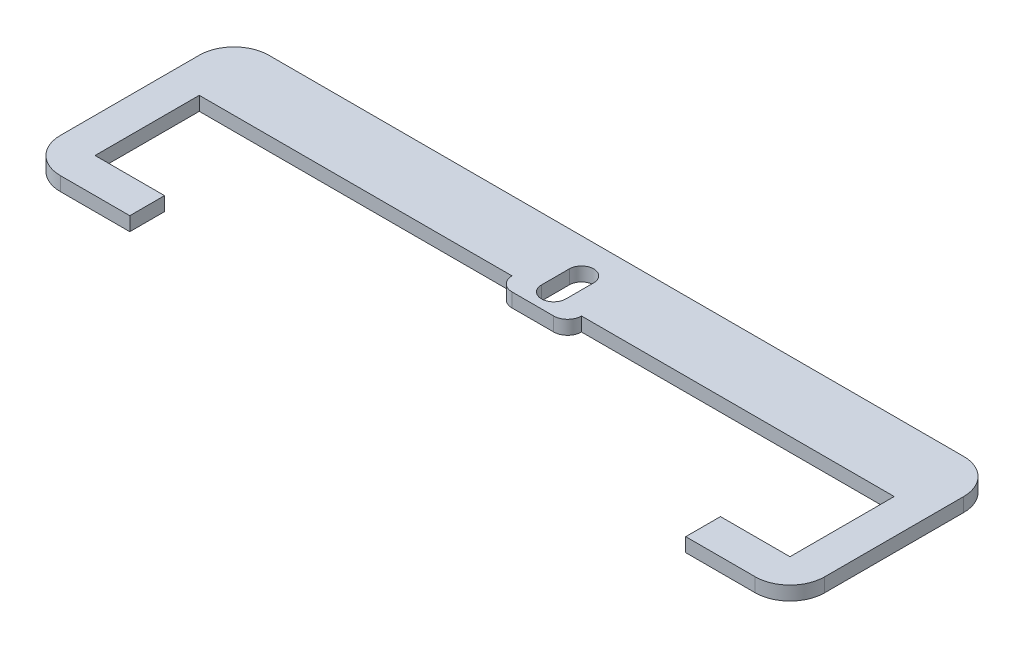
from build123d import *

# Parameters (mm, degrees)
SKETCH1_W           = 279.4
SKETCH1_H           = 76.2
BOSS_EXTRUDE1_DEPTH = 5.08
SKETCH2_W           = 254
SKETCH2_H           = 38.1
CUT_EXTRUDE1_DEPTH  = 145.891360681
FILLET1_R           = 12.7
FILLET2_R           = 12.7
SKETCH4_W           = 203.2
SKETCH4_H           = 12.7
CUT_EXTRUDE2_DEPTH  = 145.891360681
SKETCH5_W           = 25.4
SKETCH5_H           = 5.08
BOSS_EXTRUDE2_DEPTH = 5.08
FILLET3_R           = 5.08
CUT_EXTRUDE4_DEPTH  = 145.891360681


with BuildPart() as part:
    # Sketch1 → Boss-Extrude1 (new body)
    with BuildSketch(Plane(origin=(0, 0, 0), x_dir=(1, 0, 0), z_dir=(0, 1, 0))):
        Rectangle(SKETCH1_W, SKETCH1_H)
    extrude(amount=BOSS_EXTRUDE1_DEPTH)

    # Sketch2 → Cut-Extrude1 (cut, through all)
    with BuildSketch(Plane(origin=(0, 5.08, 0), x_dir=(1, 0, 0), z_dir=(0, 1, 0))):
        with Locations((0, -6.35)):
            Rectangle(SKETCH2_W, SKETCH2_H)
    extrude(amount=-CUT_EXTRUDE1_DEPTH, mode=Mode.SUBTRACT)

    # Fillet1
    fillet1_edges = [part.edges().sort_by_distance(p)[0] for p in [
        (-139.7, 2.54, -38.1),
        (139.7, 2.54, -38.1),
    ]]
    fillet(fillet1_edges, radius=FILLET1_R)

    # Fillet2
    fillet2_edges = [part.edges().sort_by_distance(p)[0] for p in [
        (139.7, 2.54, 38.1),
        (-139.7, 2.54, 38.1),
    ]]
    fillet(fillet2_edges, radius=FILLET2_R)

    # Sketch4 → Cut-Extrude2 (cut, through all)
    with BuildSketch(Plane(origin=(0, 5.08, 0), x_dir=(1, 0, 0), z_dir=(0, 1, 0))):
        with Locations((0, -31.75)):
            Rectangle(SKETCH4_W, SKETCH4_H)
    extrude(amount=-CUT_EXTRUDE2_DEPTH, mode=Mode.SUBTRACT)

    # Sketch5 → Boss-Extrude2 (add)
    with BuildSketch(Plane.XY.offset(-12.7)):
        with Locations((0, 2.54)):
            Rectangle(SKETCH5_W, SKETCH5_H)
    extrude(amount=BOSS_EXTRUDE2_DEPTH)

    # Fillet3
    fillet3_edges = [part.edges().sort_by_distance(p)[0] for p in [
        (-12.7, 2.54, -7.62),
        (12.7, 2.54, -7.62),
    ]]
    fillet(fillet3_edges, radius=FILLET3_R - 0.0001)  # a hair under: the kernel refuses the full size

    # Sketch6 → Cut-Extrude4 (cut, through all)
    with BuildSketch(Plane(origin=(0, 5.08, 0), x_dir=(1, 0, 0), z_dir=(0, 1, 0))):
        with BuildLine():
            Line((-4.445, 15.24), (-4.445, 25.4))
            ThreePointArc((-4.445, 25.4), (0, 29.845), (4.445, 25.4))
            Line((4.445, 25.4), (4.445, 15.24))
            ThreePointArc((4.445, 15.24), (0, 10.795), (-4.445, 15.24))
        make_face()
    extrude(amount=-CUT_EXTRUDE4_DEPTH, mode=Mode.SUBTRACT)


solid = part.part
